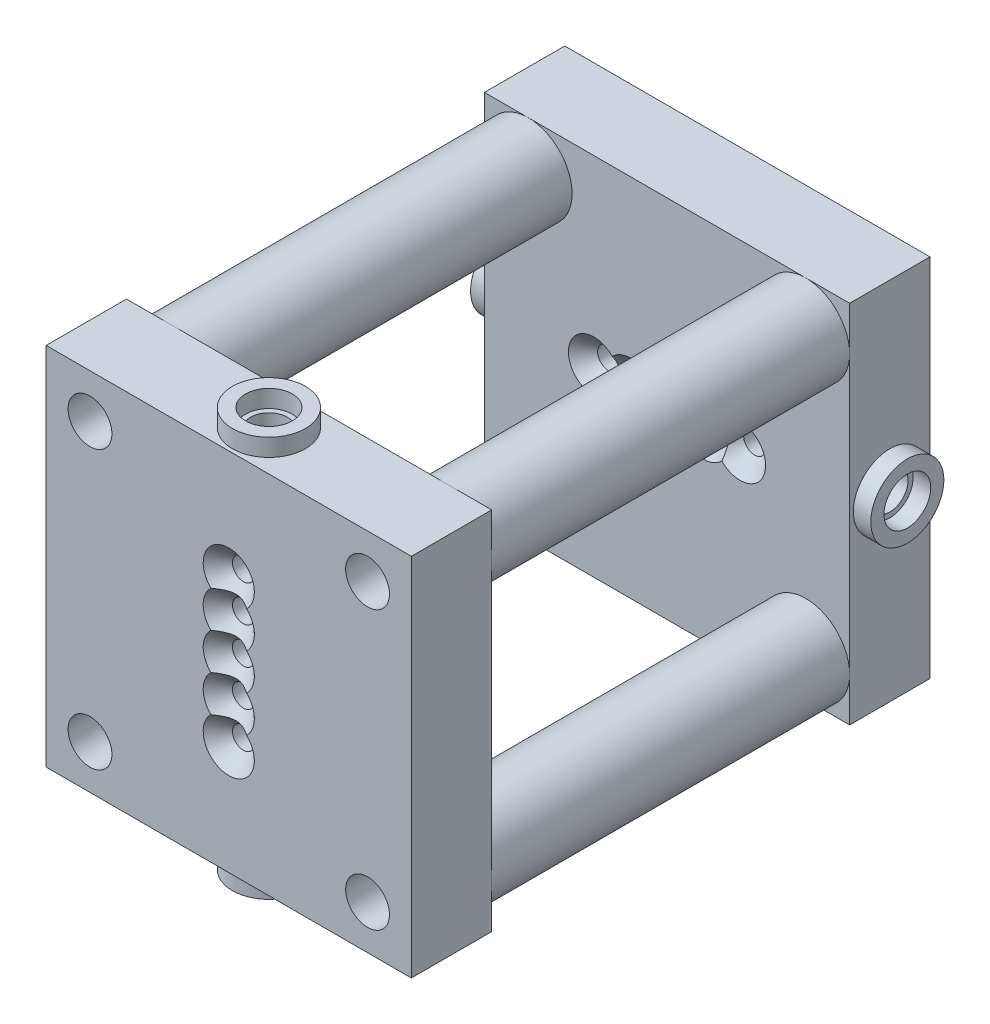
from build123d import *

# Parameters (mm, degrees)
SKETCH_1_W                  = 25
SKETCH_1_H                  = 25
SKETCH_1_R                  = 0.75
EXTRUDE_1_DEPTH             = 5.5
SKETCH_17_R                 = 2.5
SKETCH_17_R_2               = 1.6
EXTRUDE_3_DEPTH             = 1.2
CHAMFER_1_SIZE              = 1
PATTERN_LINEAR_1_COUNT      = 2
PATTERN_LINEAR_1_PITCH      = 30
MOVE_BODY_1_ANGLE           = 90
SKETCH_3_W                  = 1.5
SKETCH_3_H                  = 35.742873133
HOLE_WIZARD_M3_1_AT_2_COUNT = 2
HOLE_WIZARD_M3_1_AT_2_PITCH = 19
HOLE_WIZARD_M3_1_AT_3_COUNT = 2
HOLE_WIZARD_M3_1_AT_3_PITCH = 26.870057685
HOLE_WIZARD_M3_1_AT_4_COUNT = 2
HOLE_WIZARD_M3_1_AT_4_PITCH = 19
SKETCH_4_R                  = 3
SKETCH_4_R_2                = 1.5
EXTRUDE_2_DEPTH             = 24.5
EXTRUDE_2_2_DEPTH           = 24.5
EXTRUDE_2_3_DEPTH           = 24.5
EXTRUDE_2_4_DEPTH           = 24.5


with BuildPart() as part:
    # ｽｹｯﾁ1 → ﾎﾞｽ - 押し出し1 (new body)
    with BuildSketch(Plane.XY):
        Rectangle(SKETCH_1_W, SKETCH_1_H)
        Circle(SKETCH_1_R, mode=Mode.SUBTRACT)
        with Locations((2.5, 0)):
            Circle(SKETCH_1_R, mode=Mode.SUBTRACT)
        with Locations((5, 0)):
            Circle(SKETCH_1_R, mode=Mode.SUBTRACT)
        with Locations(Location((-5, 0, 0), (0, 0, 180))):
            Circle(SKETCH_1_R, mode=Mode.SUBTRACT)
        with Locations(Location((-2.5, 0, 0), (0, 0, 180))):
            Circle(SKETCH_1_R, mode=Mode.SUBTRACT)
    extrude(amount=EXTRUDE_1_DEPTH)

    # ｽｹｯﾁ16 → M3x0.5 ねじ穴1 (revolve, cut)
    with BuildSketch(Plane(origin=(-12.5, 0, 2.75), x_dir=(0, 0, 1), z_dir=(0, 1, 0))):
        Polygon((0, 0), (0, 5.751075774), (1.25, 5), (1.25, 0), align=None)
    m3x0_5_1 = revolve(axis=Axis((-18.85, 0, 2.75), (1, 0, 0)), mode=Mode.SUBTRACT)

    # 面取り1
    # the kernel refuses this chamfer: 1 mm, written as the material it takes off along each edge
    with BuildSketch(Plane(origin=(0, 0, 0), x_dir=(1, 0, 0), z_dir=(0, -1, 0))) as chamfer_1_piece_1:
        Polygon((0.75 + CHAMFER_1_SIZE, 0), (0.75, CHAMFER_1_SIZE), (0.75, 0), align=None)
    revolve(axis=Axis((0, 0, 0), (0, 0, 1)), mode=Mode.SUBTRACT)
    with BuildSketch(Plane(origin=(0, 0, 5.5), x_dir=(1, 0, 0), z_dir=(0, -1, 0))) as chamfer_1_piece_2:
        Polygon((0.75 + CHAMFER_1_SIZE, 0), (0.75, -CHAMFER_1_SIZE), (0.75, 0), align=None)
    revolve(axis=Axis((0, 0, 5.5), (0, 0, 1)), mode=Mode.SUBTRACT)
    with BuildSketch(Plane(origin=(2.5, 0, 0), x_dir=(1, 0, 0), z_dir=(0, -1, 0))) as chamfer_1_piece_3:
        Polygon((0.75 + CHAMFER_1_SIZE, 0), (0.75, CHAMFER_1_SIZE), (0.75, 0), align=None)
    revolve(axis=Axis((2.5, 0, 0), (0, 0, 1)), mode=Mode.SUBTRACT)
    with BuildSketch(Plane(origin=(2.5, 0, 5.5), x_dir=(1, 0, 0), z_dir=(0, -1, 0))) as chamfer_1_piece_4:
        Polygon((0.75 + CHAMFER_1_SIZE, 0), (0.75, -CHAMFER_1_SIZE), (0.75, 0), align=None)
    revolve(axis=Axis((2.5, 0, 5.5), (0, 0, 1)), mode=Mode.SUBTRACT)
    with BuildSketch(Plane(origin=(5, 0, 0), x_dir=(1, 0, 0), z_dir=(0, -1, 0))) as chamfer_1_piece_5:
        Polygon((0.75 + CHAMFER_1_SIZE, 0), (0.75, CHAMFER_1_SIZE), (0.75, 0), align=None)
    revolve(axis=Axis((5, 0, 0), (0, 0, 1)), mode=Mode.SUBTRACT)
    with BuildSketch(Plane(origin=(5, 0, 5.5), x_dir=(1, 0, 0), z_dir=(0, -1, 0))) as chamfer_1_piece_6:
        Polygon((0.75 + CHAMFER_1_SIZE, 0), (0.75, -CHAMFER_1_SIZE), (0.75, 0), align=None)
    revolve(axis=Axis((5, 0, 5.5), (0, 0, 1)), mode=Mode.SUBTRACT)
    with BuildSketch(Plane(origin=(-5, 0, 0), x_dir=(-1, 0, 0), z_dir=(0, 1, 0))) as chamfer_1_piece_7:
        Polygon((0.75 + CHAMFER_1_SIZE, 0), (0.75, CHAMFER_1_SIZE), (0.75, 0), align=None)
    revolve(axis=Axis((-5, 0, 0), (0, 0, 1)), mode=Mode.SUBTRACT)
    with BuildSketch(Plane(origin=(-5, 0, 5.5), x_dir=(-1, 0, 0), z_dir=(0, 1, 0))) as chamfer_1_piece_8:
        Polygon((0.75 + CHAMFER_1_SIZE, 0), (0.75, -CHAMFER_1_SIZE), (0.75, 0), align=None)
    revolve(axis=Axis((-5, 0, 5.5), (0, 0, 1)), mode=Mode.SUBTRACT)
    with BuildSketch(Plane(origin=(-2.5, 0, 0), x_dir=(-1, 0, 0), z_dir=(0, 1, 0))) as chamfer_1_piece_9:
        Polygon((0.75 + CHAMFER_1_SIZE, 0), (0.75, CHAMFER_1_SIZE), (0.75, 0), align=None)
    revolve(axis=Axis((-2.5, 0, 0), (0, 0, 1)), mode=Mode.SUBTRACT)
    with BuildSketch(Plane(origin=(-2.5, 0, 5.5), x_dir=(-1, 0, 0), z_dir=(0, 1, 0))) as chamfer_1_piece_10:
        Polygon((0.75 + CHAMFER_1_SIZE, 0), (0.75, -CHAMFER_1_SIZE), (0.75, 0), align=None)
    revolve(axis=Axis((-2.5, 0, 5.5), (0, 0, 1)), mode=Mode.SUBTRACT)

    # ﾐﾗｰ1: M3x0.5 ねじ穴1 across plane
    add(m3x0_5_1.mirror(Plane(origin=(0, 0, 0), x_dir=(0, 0, 1), z_dir=(1, 0, 0))), mode=Mode.SUBTRACT)


with BuildPart() as body_2:
    # ｽｹｯﾁ17 → ﾎﾞｽ - 押し出し3 (new body)
    with BuildSketch(Plane.ZY.offset(12.5)):
        with Locations(Location((2.75, 0, 0), (0, 0, 270))):
            Circle(SKETCH_17_R)
        with Locations(Location((2.75, 0, 0), (0, 0, 270))):
            Circle(SKETCH_17_R_2, mode=Mode.SUBTRACT)
    extrude(amount=EXTRUDE_3_DEPTH)


with BuildPart() as body_3:
    # ﾐﾗｰ2: mirrored copy
    add(body_2.part.mirror(Plane(origin=(0, 0, 0), x_dir=(0, 0, 1), z_dir=(1, 0, 0))))


with BuildPart() as pattern_linear_1_1:
    # 直線ﾊﾟﾀｰﾝ1: pattern copy
    add(body_3.part.moved(Location(Vector(0, 0, 1) * (1 * PATTERN_LINEAR_1_PITCH))))


with BuildPart() as pattern_linear_1_2:
    # 直線ﾊﾟﾀｰﾝ1: pattern copy
    add(body_2.part.moved(Location(Vector(0, 0, 1) * (1 * PATTERN_LINEAR_1_PITCH))))


with BuildPart() as pattern_linear_1_3:
    # 直線ﾊﾟﾀｰﾝ1: pattern copy
    add(part.part.moved(Location(Vector(0, 0, 1) * (1 * PATTERN_LINEAR_1_PITCH))))


with BuildPart() as pattern_linear_1_3_1:
    # Move Body 1: moved
    add(pattern_linear_1_3.part.rotate(Axis((0, 0, 0), (0, 0, 1)), MOVE_BODY_1_ANGLE))


with BuildPart() as pattern_linear_1_1_1:
    # Move Body 1: moved
    add(pattern_linear_1_1.part.rotate(Axis((0, 0, 0), (0, 0, 1)), MOVE_BODY_1_ANGLE))


with BuildPart() as pattern_linear_1_2_1:
    # Move Body 1: moved
    add(pattern_linear_1_2.part.rotate(Axis((0, 0, 0), (0, 0, 1)), MOVE_BODY_1_ANGLE))


with BuildPart() as hole_wizard_m3_1_tool:
    # ｽｹｯﾁ3 → M3 すきま穴1 (revolve)
    with BuildSketch(Plane(origin=(9.5, 9.5, 35.5), x_dir=(0, -1, 0), z_dir=(1, 0, 0))):
        with Locations((0.75, 17.871436567)):
            Rectangle(SKETCH_3_W, SKETCH_3_H)
    hole_wizard_m3_1 = revolve(axis=Axis((9.5, 9.5, 41.85), (0, 0, -1)))


with BuildPart() as part_1:
    add(part.part)

    # M3 すきま穴1: cut by hole_wizard_m3_1_tool
    add(hole_wizard_m3_1_tool.part, mode=Mode.SUBTRACT)


with BuildPart() as pattern_linear_1_3_2:
    add(pattern_linear_1_3_1.part)

    # M3 すきま穴1: cut by hole_wizard_m3_1_tool
    add(hole_wizard_m3_1_tool.part, mode=Mode.SUBTRACT)


with BuildPart() as hole_wizard_m3_1_at_2_tool:
    # M3 すきま穴1 at 2: M3 すきま穴1 ×2
    with Locations(*[(0, -i * HOLE_WIZARD_M3_1_AT_2_PITCH, 0) for i in range(1, HOLE_WIZARD_M3_1_AT_2_COUNT)]):
        add(hole_wizard_m3_1)


with BuildPart() as part_2:
    add(part_1.part)

    # M3 すきま穴1 at 2: cut by hole_wizard_m3_1_at_2_tool
    add(hole_wizard_m3_1_at_2_tool.part, mode=Mode.SUBTRACT)


with BuildPart() as pattern_linear_1_3_3:
    add(pattern_linear_1_3_2.part)

    # M3 すきま穴1 at 2: cut by hole_wizard_m3_1_at_2_tool
    add(hole_wizard_m3_1_at_2_tool.part, mode=Mode.SUBTRACT)


with BuildPart() as hole_wizard_m3_1_at_3_tool:
    # M3 すきま穴1 at 3: M3 すきま穴1 ×2
    with Locations(*[Vector(-0.7071067811865502, -0.7071067811865449, 0) * (i * HOLE_WIZARD_M3_1_AT_3_PITCH) for i in range(1, HOLE_WIZARD_M3_1_AT_3_COUNT)]):
        add(hole_wizard_m3_1)


with BuildPart() as part_3:
    add(part_2.part)

    # M3 すきま穴1 at 3: cut by hole_wizard_m3_1_at_3_tool
    add(hole_wizard_m3_1_at_3_tool.part, mode=Mode.SUBTRACT)


with BuildPart() as pattern_linear_1_3_4:
    add(pattern_linear_1_3_3.part)

    # M3 すきま穴1 at 3: cut by hole_wizard_m3_1_at_3_tool
    add(hole_wizard_m3_1_at_3_tool.part, mode=Mode.SUBTRACT)


with BuildPart() as hole_wizard_m3_1_at_4_tool:
    # M3 すきま穴1 at 4: M3 すきま穴1 ×2
    with Locations(*[(-i * HOLE_WIZARD_M3_1_AT_4_PITCH, 0, 0) for i in range(1, HOLE_WIZARD_M3_1_AT_4_COUNT)]):
        add(hole_wizard_m3_1)


with BuildPart() as part_4:
    add(part_3.part)

    # M3 すきま穴1 at 4: cut by hole_wizard_m3_1_at_4_tool
    add(hole_wizard_m3_1_at_4_tool.part, mode=Mode.SUBTRACT)


with BuildPart() as pattern_linear_1_3_5:
    add(pattern_linear_1_3_4.part)

    # M3 すきま穴1 at 4: cut by hole_wizard_m3_1_at_4_tool
    add(hole_wizard_m3_1_at_4_tool.part, mode=Mode.SUBTRACT)


with BuildPart() as body_7:
    # ｽｹｯﾁ4 → ﾎﾞｽ - 押し出し2 (new body)
    with BuildSketch(Plane.XY.offset(5.5)):
        with Locations((9.5, 9.5)):
            Circle(SKETCH_4_R)
        with Locations((9.5, 9.5)):
            Circle(SKETCH_4_R_2, mode=Mode.SUBTRACT)
    extrude(amount=EXTRUDE_2_DEPTH)


with BuildPart() as body_8:
    # ｽｹｯﾁ4 → Extrude 2 2 (new body)
    with BuildSketch(Plane.XY.offset(5.5)):
        with Locations((9.5, -9.5)):
            Circle(SKETCH_4_R)
        with Locations((9.5, -9.5)):
            Circle(SKETCH_4_R_2, mode=Mode.SUBTRACT)
    extrude(amount=EXTRUDE_2_2_DEPTH)


with BuildPart() as body_9:
    # ｽｹｯﾁ4 → Extrude 2 3 (new body)
    with BuildSketch(Plane.XY.offset(5.5)):
        with Locations((-9.5, -9.5)):
            Circle(SKETCH_4_R)
        with Locations((-9.5, -9.5)):
            Circle(SKETCH_4_R_2, mode=Mode.SUBTRACT)
    extrude(amount=EXTRUDE_2_3_DEPTH)


with BuildPart() as body_10:
    # ｽｹｯﾁ4 → Extrude 2 4 (new body)
    with BuildSketch(Plane.XY.offset(5.5)):
        with Locations((-9.5, 9.5)):
            Circle(SKETCH_4_R)
        with Locations((-9.5, 9.5)):
            Circle(SKETCH_4_R_2, mode=Mode.SUBTRACT)
    extrude(amount=EXTRUDE_2_4_DEPTH)


solid = Compound([body_2.part, body_3.part, pattern_linear_1_1_1.part, pattern_linear_1_2_1.part, part_4.part, pattern_linear_1_3_5.part, body_7.part, body_8.part, body_9.part, body_10.part])
